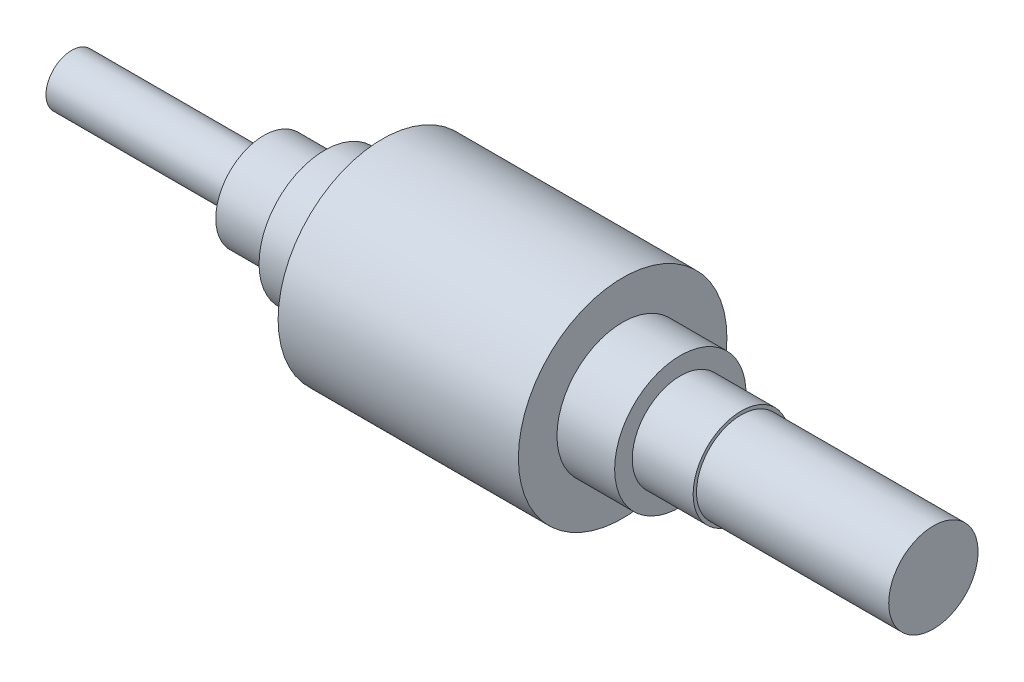
from build123d import *


with BuildPart() as part:
    # Çizim1 → Döndür1 (revolve)
    with BuildSketch(Plane.XY):
        Polygon((30, 7.5), (39.5, 7.5), (39.5, 10.25), (48.5, 10.25), (48.5, 16.275), (86, 16.275), (86, 10.25), (95, 10.25), (95, 7.5), (104.5, 7.5), (104.5, 6.975), (134.5, 6.975), (134.5, 0), (0, 0), (0, 4), (30, 4), align=None)
    revolve(axis=Axis((0, 0, 0), (1, 0, 0)))


solid = part.part
